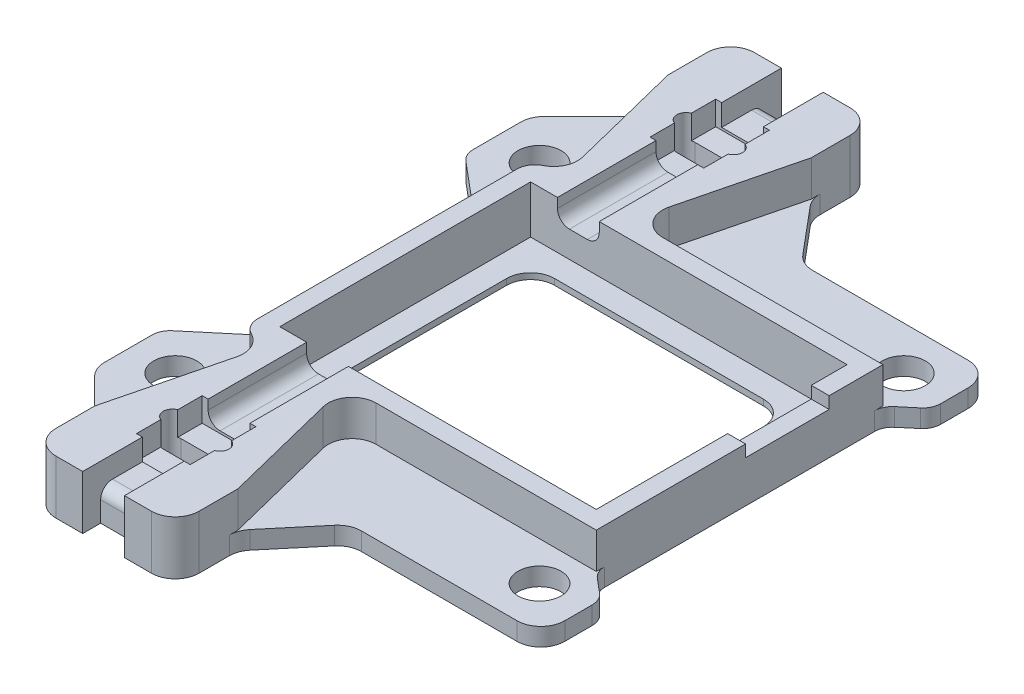
from build123d import *

# Parameters (mm, degrees)
SKIZZE1_W                                     = 38
SKIZZE1_H                                     = 48
GRUNDPLATTE_DEPTH                             = 1.5
SKIZZE2_R                                     = 1.8
FC_BOHRUNGEN_DEPTH                            = 1.5
SKIZZE3_W                                     = 26.5
SKIZZE3_H                                     = 21
AUSCHNITT_EMPF_NGER_DEPTH                     = 31.647185841
SKIZZE4_W                                     = 26.5
SKIZZE4_H                                     = 21
SKIZZE4_W_2                                   = 21.5
SKIZZE4_H_2                                   = 17
AUFLAGEEMPF_NGER_DEPTH                        = 0.5
VERRUNDUNG1_R                                 = 2
LANGLOCHKABELBINDER_DEPTH                     = 31.647185841
SKIZZE8_W                                     = 12
SKIZZE8_H                                     = 5.25
AUFSATZ_LINEAR_AUSTRAGEN7_DEPTH               = 1.5
SKIZZE10_W                                    = 29.5
SKIZZE10_H                                    = 24
SKIZZE10_W_2                                  = 26.5
SKIZZE10_H_2                                  = 21
HALTERAHMEN_EMPF_NGER_DEPTH                   = 3
DURCHBRUCH_EMPF_NGER_REACH                    = 48.41
SKIZZE11_W                                    = 7
SKIZZE11_H                                    = 1
VERST_RKUNG_KABELBINDER_DEPTH                 = 3
VERRUNDUNG_VERST_RKUNG_KABELBINDER_R          = 2
AUSSCHNITT_ANTENNENANSATZEMPF_NGER_DEPTH      = 45.286707938
AUSSCHNITT_ANTENNENANSATZEMPF_NGER_DEPTH_BACK = 45.286707938
SKIZZE13_W                                    = 3.5
SKIZZE13_H                                    = 1.8
LANGLOCH_REPARATUR_DEPTH                      = 36.168345142
SKIZZE15_W                                    = 3.5
SKIZZE15_H                                    = 1.5
SCHNITT_LINEAR_AUSTRAGEN8_DEPTH               = 35.983603302
SKIZZE16_W                                    = 4.5
SKIZZE16_H                                    = 5.5
SCHNITT_LINEAR_AUSTRAGEN9_DEPTH               = 2
SCHNITT_LINEAR_AUSTRAGEN10_DEPTH              = 36.008034792
VERRUNDUNG6_R                                 = 1
VERRUNDUNG7_R                                 = 1.5
VERRUNDUNG8_R                                 = 1
VERRUNDUNG4_R                                 = 2
VERRUNDUNG5_R                                 = 1.5


with BuildPart() as part:
    # Skizze1 → Grundplatte (new body)
    with BuildSketch(Plane(origin=(0, 0, 0), x_dir=(1, 0, 0), z_dir=(0, 1, 0))):
        Rectangle(SKIZZE1_W, SKIZZE1_H)
    extrude(amount=GRUNDPLATTE_DEPTH)

    # Skizze2 → FC-Bohrungen (cut)
    with BuildSketch(Plane(origin=(0, 1.5, 0), x_dir=(1, 0, 0), z_dir=(0, 1, 0))):
        with Locations(Location((-15.25, 15.25, 0), (0, 0, 270))):
            Circle(SKIZZE2_R)
        with Locations(Location((15.25, 15.25, 0), (0, 0, 270))):
            Circle(SKIZZE2_R)
        with Locations(Location((15.25, -15.25, 0), (0, 0, 270))):
            Circle(SKIZZE2_R)
        with Locations(Location((-15.25, -15.25, 0), (0, 0, 270))):
            Circle(SKIZZE2_R)
    extrude(amount=-FC_BOHRUNGEN_DEPTH, mode=Mode.SUBTRACT)

    # Skizze3 → Auschnitt Empfänger (cut, through all)
    with BuildSketch(Plane(origin=(0, 1.5, 0), x_dir=(1, 0, 0), z_dir=(0, 1, 0))):
        with Locations((2, 0)):
            Rectangle(SKIZZE3_W, SKIZZE3_H)
    extrude(amount=-AUSCHNITT_EMPF_NGER_DEPTH, mode=Mode.SUBTRACT)

    # Skizze4 → AuflageEMpfänger (add)
    with BuildSketch(Plane.XZ):
        with Locations((2, 0)):
            Rectangle(SKIZZE4_W, SKIZZE4_H)
        with Locations((1.5, 0)):
            Rectangle(SKIZZE4_W_2, SKIZZE4_H_2, mode=Mode.SUBTRACT)
    extrude(amount=-AUFLAGEEMPF_NGER_DEPTH)

    # Verrundung1
    verrundung1_edges = [part.edges().sort_by_distance(p)[0] for p in [
        (-9.25, 0.25, 8.5),
        (12.25, 0.25, 8.5),
        (12.25, 0.25, -8.5),
        (-9.25, 0.25, -8.5),
    ]]
    fillet(verrundung1_edges, radius=VERRUNDUNG1_R)

    # Skizze7 → LanglochKabelbinder (cut, through all)
    with BuildSketch(Plane(origin=(0, 1.5, 0), x_dir=(1, 0, 0), z_dir=(0, 1, 0))):
        with BuildLine():
            Line((-9.25, 22.25), (-5.25, 22.25))
            ThreePointArc((-5.25, 22.25), (-4.5, 21.5), (-5.25, 20.75))
            Line((-5.25, 20.75), (-9.25, 20.75))
            ThreePointArc((-9.25, 20.75), (-10, 21.5), (-9.25, 22.25))
        make_face()
        with BuildLine():
            Line((-5.25, -22.25), (-9.25, -22.25))
            ThreePointArc((-9.25, -22.25), (-10, -21.5), (-9.25, -20.75))
            Line((-9.25, -20.75), (-5.25, -20.75))
            ThreePointArc((-5.25, -20.75), (-4.5, -21.5), (-5.25, -22.25))
        make_face()
    extrude(amount=-LANGLOCHKABELBINDER_DEPTH, mode=Mode.SUBTRACT)

    # Skizze8 → Aufsatz-Linear austragen7 (add, through all)
    with BuildSketch(Plane.XZ):
        with Locations((-7.25, 26.625)):
            Rectangle(SKIZZE8_W, SKIZZE8_H)
        with Locations((-7.25, -26.625)):
            Rectangle(SKIZZE8_W, SKIZZE8_H)
    extrude(amount=-AUFSATZ_LINEAR_AUSTRAGEN7_DEPTH)

    # Skizze10 → Halterahmen Empfänger (add)
    with BuildSketch(Plane(origin=(0, 1.5, 0), x_dir=(1, 0, 0), z_dir=(0, 1, 0))):
        with Locations((2, 0)):
            Rectangle(SKIZZE10_W, SKIZZE10_H)
        with Locations((2, 0)):
            Rectangle(SKIZZE10_W_2, SKIZZE10_H_2, mode=Mode.SUBTRACT)
    extrude(amount=HALTERAHMEN_EMPF_NGER_DEPTH)

    # Skizze11 → Durchbruch Empfänger (cut, up to next)
    with BuildSketch(Plane(origin=(16.75, 0, 0), x_dir=(0, 0, -1), z_dir=(1, 0, 0)), mode=Mode.PRIVATE) as durchbruch_empf_nger_sk1:
        with Locations((4, 4)):
            Rectangle(SKIZZE11_W, SKIZZE11_H)
    durchbruch_empf_nger_tool1 = extrude(durchbruch_empf_nger_sk1.sketch, amount=-DURCHBRUCH_EMPF_NGER_REACH, mode=Mode.PRIVATE) & part.part
    add(durchbruch_empf_nger_tool1.solids().sort_by_distance((16.75, 4, -4))[0], mode=Mode.SUBTRACT)

    # Skizze12 → Verstärkung Kabelbinder (add)
    with BuildSketch(Plane(origin=(0, 1.5, 0), x_dir=(1, 0, 0), z_dir=(0, 1, 0))):
        Polygon((-13.25, -24), (-13.25, -29.25), (-1.25, -29.25), (-1.25, -24), (-4.25, -12), (-10.25, -12), align=None)
        Polygon((-10.25, 12), (-13.25, 24), (-13.25, 29.25), (-1.25, 29.25), (-1.25, 24), (-4.25, 12), align=None)
    extrude(amount=VERST_RKUNG_KABELBINDER_DEPTH)

    # Verrundung Verstärkung Kabelbinder
    # the kernel refuses this fillet: 2 mm, written as the material it adds along each edge
    with BuildSketch(Plane(origin=(-4.25, 1.5, -12), x_dir=(0.2425356250363328, 0, -0.9701425001453319), z_dir=(0, 1, 0)), Plane(origin=(-4.25, 1.5, 12), x_dir=(1, 0, 0), z_dir=(0, 1, 0))) as verrundung_verst_rkung_kabelbinder_piece_1:
        with BuildLine():
            CenterArc((VERRUNDUNG_VERST_RKUNG_KABELBINDER_R * 1.2807764064, -VERRUNDUNG_VERST_RKUNG_KABELBINDER_R), VERRUNDUNG_VERST_RKUNG_KABELBINDER_R, 90, 104.036243468)
            Line((VERRUNDUNG_VERST_RKUNG_KABELBINDER_R * 0.310633906259, -VERRUNDUNG_VERST_RKUNG_KABELBINDER_R * 1.24253562504), (0, 0))
            Line((0, 0), (VERRUNDUNG_VERST_RKUNG_KABELBINDER_R * 1.2807764064, 0))
        make_face()
    extrude(amount=3)
    with BuildSketch(Plane(origin=(-10.25, 1.5, -12), x_dir=(-1, 0, 0), z_dir=(0, 1, 0))) as verrundung_verst_rkung_kabelbinder_piece_2_section:
        with BuildLine():
            CenterArc((VERRUNDUNG_VERST_RKUNG_KABELBINDER_R * 1.2807764064, -VERRUNDUNG_VERST_RKUNG_KABELBINDER_R), VERRUNDUNG_VERST_RKUNG_KABELBINDER_R, 90, 104.036243468)
            Line((VERRUNDUNG_VERST_RKUNG_KABELBINDER_R * 0.310633906259, -VERRUNDUNG_VERST_RKUNG_KABELBINDER_R * 1.24253562504), (0, 0))
            Line((0, 0), (VERRUNDUNG_VERST_RKUNG_KABELBINDER_R * 1.2807764064, 0))
        make_face()
    verrundung_verst_rkung_kabelbinder_piece_2 = extrude(amount=3, mode=Mode.PRIVATE)
    verrundung_verst_rkung_kabelbinder_piece_2 = split(verrundung_verst_rkung_kabelbinder_piece_2, bisect_by=Plane(origin=(-12.75, 3, -12.581943017), z_dir=(1, 0, 0)), keep=Keep.TOP, mode=Mode.PRIVATE)
    add(verrundung_verst_rkung_kabelbinder_piece_2)
    with BuildSketch(Plane(origin=(-10.25, 1.5, 12), x_dir=(-1, 0, 0), z_dir=(0, 1, 0))) as verrundung_verst_rkung_kabelbinder_piece_3_section:
        with BuildLine():
            CenterArc((VERRUNDUNG_VERST_RKUNG_KABELBINDER_R * 1.2807764064, VERRUNDUNG_VERST_RKUNG_KABELBINDER_R), VERRUNDUNG_VERST_RKUNG_KABELBINDER_R, 165.963756532, 104.036243468)
            Line((VERRUNDUNG_VERST_RKUNG_KABELBINDER_R * 0.310633906259, VERRUNDUNG_VERST_RKUNG_KABELBINDER_R * 1.24253562504), (0, 0))
            Line((0, 0), (VERRUNDUNG_VERST_RKUNG_KABELBINDER_R * 1.2807764064, 0))
        make_face()
    verrundung_verst_rkung_kabelbinder_piece_3 = extrude(amount=3, mode=Mode.PRIVATE)
    verrundung_verst_rkung_kabelbinder_piece_3 = split(verrundung_verst_rkung_kabelbinder_piece_3, bisect_by=Plane(origin=(-12.75, 3, 12.581943017), z_dir=(1, 0, 0)), keep=Keep.TOP, mode=Mode.PRIVATE)
    add(verrundung_verst_rkung_kabelbinder_piece_3)

    # Skizze13 → Ausschnitt AntennenAnsatzEmpfänger (cut, two sides: drawn at the far end of the back side and taken through both)
    with BuildSketch(Plane.XY.offset(-10.5).offset(-AUSSCHNITT_ANTENNENANSATZEMPF_NGER_DEPTH_BACK)):
        with Locations((-7.25, 3.6)):
            Rectangle(SKIZZE13_W, SKIZZE13_H)
    extrude(amount=AUSSCHNITT_ANTENNENANSATZEMPF_NGER_DEPTH + AUSSCHNITT_ANTENNENANSATZEMPF_NGER_DEPTH_BACK, mode=Mode.SUBTRACT)

    # Skizze14 → Langloch Reparatur (cut, through all)
    with BuildSketch(Plane.XZ):
        with BuildLine():
            Line((-5.25, 20.75), (-9.25, 20.75))
            ThreePointArc((-9.25, 20.75), (-10, 21.5), (-9.25, 22.25))
            Line((-9.25, 22.25), (-5.25, 22.25))
            ThreePointArc((-5.25, 22.25), (-4.5, 21.5), (-5.25, 20.75))
        make_face()
        with BuildLine():
            Line((-5.25, -22.25), (-9.25, -22.25))
            ThreePointArc((-9.25, -22.25), (-10, -21.5), (-9.25, -20.75))
            Line((-9.25, -20.75), (-5.25, -20.75))
            ThreePointArc((-5.25, -20.75), (-4.5, -21.5), (-5.25, -22.25))
        make_face()
    extrude(amount=-LANGLOCH_REPARATUR_DEPTH, mode=Mode.SUBTRACT)

    # Skizze15 → Schnitt-Linear austragen8 (cut, through all)
    with BuildSketch(Plane(origin=(0, 2.7, 0), x_dir=(1, 0, 0), z_dir=(0, 1, 0))):
        with Locations((-7.25, 28.5)):
            Rectangle(SKIZZE15_W, SKIZZE15_H)
        with Locations((-7.25, -28.5)):
            Rectangle(SKIZZE15_W, SKIZZE15_H)
    extrude(amount=-SCHNITT_LINEAR_AUSTRAGEN8_DEPTH, mode=Mode.SUBTRACT)

    # Skizze16 → Schnitt-Linear austragen9 (cut)
    with BuildSketch(Plane(origin=(0, 4.5, 0), x_dir=(1, 0, 0), z_dir=(0, 1, 0))):
        with Locations((-7.25, 21.5)):
            Rectangle(SKIZZE16_W, SKIZZE16_H)
        with Locations((-7.25, -21.5)):
            Rectangle(SKIZZE16_W, SKIZZE16_H)
    extrude(amount=-SCHNITT_LINEAR_AUSTRAGEN9_DEPTH, mode=Mode.SUBTRACT)

    # Skizze17 → Schnitt-Linear austragen10 (cut, through all)
    with BuildSketch(Plane(origin=(0, 1.5, 0), x_dir=(1, 0, 0), z_dir=(0, 1, 0))):
        Polygon((16.75, 12), (19, 13.88797417), (19, -13.88797417), (16.75, -12), align=None)
        Polygon((-12.75, 7.5), (-19, 12.744372695), (-19, -12.744372695), (-12.75, -7.5), align=None)
        Polygon((-19, 18.25), (-13.25, 24), (-19, 24), align=None)
        Polygon((-1.25, 24), (3.039498988, 18.88797417), (19, 18.88797417), (19, 24), align=None)
        Polygon((-19, -24), (-19, -18.25), (-13.25, -24), align=None)
        Polygon((19, -24), (-1.25, -24), (3.039498988, -18.88797417), (19, -18.88797417), align=None)
    extrude(amount=-SCHNITT_LINEAR_AUSTRAGEN10_DEPTH, mode=Mode.SUBTRACT)

    # Verrundung6
    verrundung6_edges = [part.edges().sort_by_distance(p)[0] for p in [
        (-7.25, 2.7, -27.75),
        (-7.25, 2.7, 27.75),
    ]]
    fillet(verrundung6_edges, radius=VERRUNDUNG6_R)

    # Verrundung7
    verrundung7_edges = [part.edges().sort_by_distance(p)[0] for p in [
        (16.75, 0.75, 12),
        (16.75, 0.75, -12),
        (19, 0.75, -13.88797417),
        (19, 0.75, 13.88797417),
        (-12.75, 0.75, -7.5),
        (-12.75, 0.75, 7.5),
        (-19, 0.75, 12.744372695),
        (-19, 0.75, -12.744372695),
    ]]
    fillet(verrundung7_edges, radius=VERRUNDUNG7_R)

    # Verrundung8
    verrundung8_edges = [part.edges().sort_by_distance(p)[0] for p in [
        (-5.5, 2.7, 14.625),
        (-9, 2.7, 14.625),
        (-5.5, 2.7, -14.625),
        (-9, 2.7, -14.625),
    ]]
    fillet(verrundung8_edges, radius=VERRUNDUNG8_R)

    # Verrundung4
    verrundung4_edges = [part.edges().sort_by_distance(p)[0] for p in [
        (-13.25, 2.25, 29.25),
        (-1.25, 2.25, 29.25),
        (-1.25, 2.25, -29.25),
        (-13.25, 2.25, -29.25),
        (-13.25, 0.75, -24),
        (-19, 0.75, -18.25),
        (-1.25, 0.75, -24),
        (3.039498988, 0.75, -18.88797417),
        (19, 0.75, -18.88797417),
        (19, 0.75, 18.88797417),
        (3.039498988, 0.75, 18.88797417),
        (-1.25, 0.75, 24),
        (-19, 0.75, 18.25),
        (-13.25, 0.75, 24),
    ]]
    fillet(verrundung4_edges, radius=VERRUNDUNG4_R)

    # Verrundung5
    verrundung5_edges = [part.edges().sort_by_distance(p)[0] for p in [
        (-12.75, 3, -12.000947412),
        (-12.75, 3, 12.000947412),
    ]]
    fillet(verrundung5_edges, radius=VERRUNDUNG5_R)


solid = part.part
